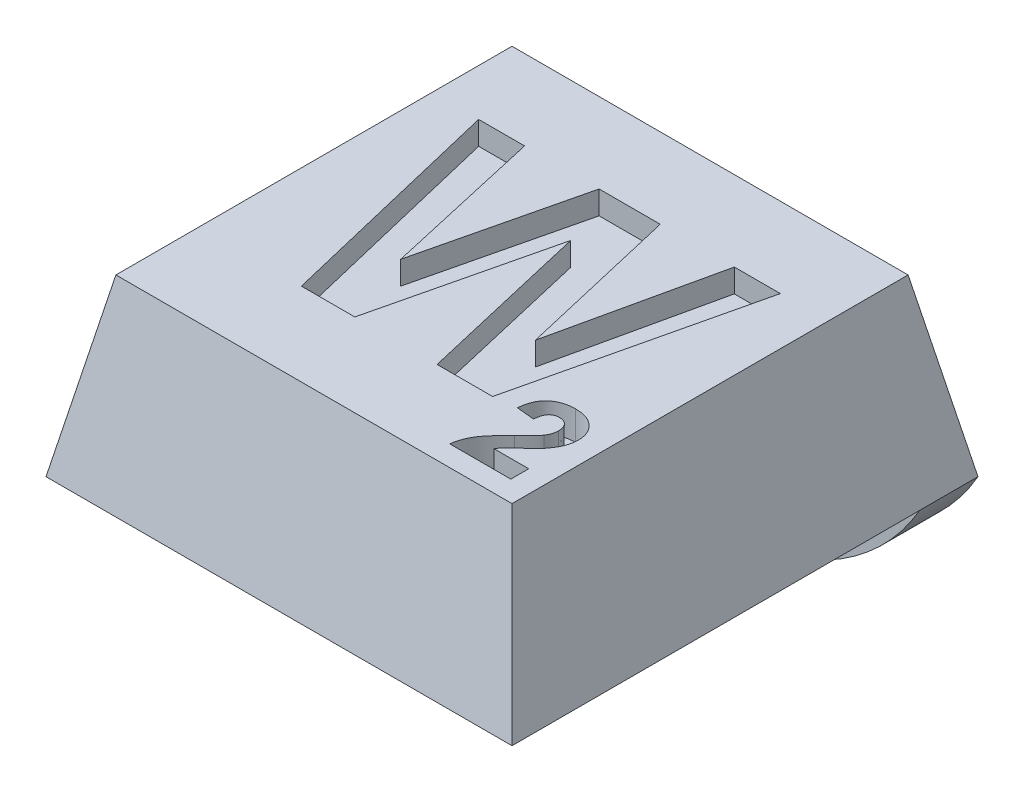
from build123d import *

# Parameters (mm, degrees)
SKETCH1_W               = 8
SKETCH1_H               = 8
BOSS_EXTRUDE1_DEPTH     = 3
CUT_EXTRUDE1_DEPTH      = 12.704699911
CUT_EXTRUDE1_DEPTH_BACK = 12.704699911
CUT_EXTRUDE2_DEPTH      = 11
SKETCH4_R               = 1.75
CUT_EXTRUDE3_DEPTH      = 0.4
SKETCH5_W               = 8
SKETCH5_H               = 1
BOSS_EXTRUDE2_DEPTH     = 2
FILLET1_R               = 4
CUT_EXTRUDE4_DEPTH      = 0.4
CUT_EXTRUDE5_DEPTH      = 0.5


with BuildPart() as part:
    # Sketch1 → Boss-Extrude1 (new body)
    with BuildSketch(Plane(origin=(0, 0, 0), x_dir=(1, 0, 0), z_dir=(0, 1, 0))):
        with Locations((4, 4)):
            Rectangle(SKETCH1_W, SKETCH1_H)
    extrude(amount=BOSS_EXTRUDE1_DEPTH)

    # Sketch2 → Cut-Extrude1 (cut, two sides: drawn at the far end of the back side and taken through both)
    with BuildSketch(Plane.XY.offset(-CUT_EXTRUDE1_DEPTH_BACK)):
        Polygon((0, 0), (0.6, 3), (0, 3), align=None)
        Polygon((8, 0), (7.4, 3), (8, 3), align=None)
    extrude(amount=CUT_EXTRUDE1_DEPTH + CUT_EXTRUDE1_DEPTH_BACK, mode=Mode.SUBTRACT)

    # Sketch3 → Cut-Extrude2 (cut)
    with BuildSketch(Plane(origin=(0, 0, 0), x_dir=(0, 0, -1), z_dir=(1, 0, 0))):
        Polygon((0, 0), (0.6, 3), (0, 3), align=None)
        Polygon((8, 3), (7.4, 3), (8, 0), align=None)
    extrude(amount=CUT_EXTRUDE2_DEPTH, mode=Mode.SUBTRACT)

    # Sketch4 → Cut-Extrude3 (cut)
    with BuildSketch(Plane.XZ):
        with Locations(Location((4, -3.75, 0), (0, 0, 270))):
            Circle(SKETCH4_R)
    extrude(amount=-CUT_EXTRUDE3_DEPTH, mode=Mode.SUBTRACT)

    # Sketch5 → Boss-Extrude2 (add)
    with BuildSketch(Plane.XZ):
        with Locations((4, -7.5)):
            Rectangle(SKETCH5_W, SKETCH5_H)
    extrude(amount=BOSS_EXTRUDE2_DEPTH)

    # Fillet1
    # the kernel refuses this fillet: 4 mm, written as the material it takes off along each edge
    with BuildSketch(Plane(origin=(8, -2, -16.660254038), x_dir=(0, 1, 0), z_dir=(0, 0, 1)), Plane(origin=(0, -2, 1.660254038), x_dir=(0, 1, 0), z_dir=(0, 0, -1))) as fillet1_piece_1:
        with BuildLine():
            CenterArc((4, 3.464101615), FILLET1_R, 180, 60)
            Line((0, 3.464101615), (-0.08, 3.464101615))
            Line((-0.08, 3.464101615), (-0.08, 0))
            Line((-0.08, 0), (0, -0.08))
            ThreePointArc((0, -0.08), (1, -0.08), (1.96, -0.069282032))
            Line((1.96, -0.069282032), (2, 0))
        make_face()
    extrude(amount=18.320508076, mode=Mode.SUBTRACT)

    # Sketch6 → Cut-Extrude4 (cut)
    with BuildSketch(Plane(origin=(0, 3, 0), x_dir=(1, 0, 0), z_dir=(0, 1, 0))):
        Polygon((2.358967796, 2.025988971), (1.401435745, 6.025988971), (2.189897284, 6.025988971), (2.811692155, 3.278392817), (3.469544719, 6.025988971), (4.519224207, 6.025988971), (5.170666514, 3.231918458), (5.790858822, 6.025988971), (6.580922925, 6.025988971), (5.641019078, 2.025988971), (4.688294719, 2.025988971), (3.991179335, 5.016373586), (3.275634463, 2.025988971), align=None)
    extrude(amount=-CUT_EXTRUDE4_DEPTH, mode=Mode.SUBTRACT)

    # Sketch7 → Cut-Extrude5 (cut)
    with BuildSketch(Plane(origin=(0, 3, 0), x_dir=(1, 0, 0), z_dir=(0, 1, 0))):
        with BuildLine():
            Line((7.025079926, 1.261869909), (7.025079926, 0.954177602))
            Line((7.025079926, 0.954177602), (5.978926079, 0.954177602))
            add(Edge.make_bspline(
                [(5.978926079, 0.954177602), (5.982468114, 0.980474374), (5.989550197, 1.033053173), (6.011445466, 1.109857564), (6.040668149, 1.184805528), (6.072383822, 1.245794978), (6.103928572, 1.294889387), (6.132549124, 1.335117725), (6.166692393, 1.37791895), (6.205862922, 1.423638586), (6.249844239, 1.472419552), (6.298964472, 1.524080492), (6.353457933, 1.578374089), (6.391795053, 1.615242112), (6.411618387, 1.634305807)],
                knots=[0, 0, 0, 0, 1.156289446, 2.311930546, 3.473459201, 4.661751613, 5.303057008, 6.018253237, 6.81459331, 7.690699809, 8.644447906, 9.679642995, 10.800191253, 12, 12, 12, 12], degree=3))
            add(Edge.make_bspline(
                [(6.411618387, 1.634305807), (6.427437635, 1.649575712), (6.457552822, 1.678645113), (6.500436909, 1.720271317), (6.538136439, 1.758537631), (6.571439659, 1.79245241), (6.599577217, 1.822879209), (6.622919237, 1.849340182), (6.641761343, 1.871943086), (6.651966244, 1.886282382), (6.656490182, 1.89263914)],
                knots=[0, 0, 0, 0, 1.480720495, 2.818855715, 4.024636094, 5.098235712, 6.019786162, 6.815086302, 7.474715479, 8, 8, 8, 8], degree=3))
            add(Edge.make_bspline(
                [(6.656490182, 1.89263914), (6.665754103, 1.908027503), (6.683623134, 1.937709873), (6.703218009, 1.984385935), (6.714979583, 2.031052356), (6.71659359, 2.062234592), (6.717387618, 2.077575038)],
                knots=[0, 0, 0, 0, 1.0911822, 2.104764037, 3.067617678, 4, 4, 4, 4], degree=3))
            add(Edge.make_bspline(
                [(6.717387618, 2.077575038), (6.716811351, 2.093538834), (6.7157211, 2.123741092), (6.706579153, 2.166362064), (6.690367393, 2.203000826), (6.668046783, 2.233769843), (6.639822327, 2.257877251), (6.606827118, 2.275690284), (6.568578157, 2.285538571), (6.541694532, 2.286833928), (6.527644028, 2.287510935)],
                knots=[0, 0, 0, 0, 1.193122327, 2.257294386, 3.237245624, 4.168877528, 5.075331632, 5.990371598, 6.949684428, 8, 8, 8, 8], degree=3))
            add(Edge.make_bspline(
                [(6.527644028, 2.287510935), (6.513688449, 2.286878661), (6.486729282, 2.285657243), (6.448414457, 2.274987105), (6.414896057, 2.256515974), (6.391009062, 2.235466338), (6.374872264, 2.214997095), (6.363877213, 2.197159499), (6.354400337, 2.17689052), (6.346003035, 2.154418352), (6.339370115, 2.129485554), (6.334028373, 2.102282013), (6.329723702, 2.072661336), (6.328354741, 2.052055079), (6.327644028, 2.041357089)],
                knots=[0, 0, 0, 0, 1.402788338, 2.709884207, 3.961032948, 5.225417836, 5.883680772, 6.578928686, 7.329201998, 8.132101139, 8.990263233, 9.922304639, 10.921339128, 12, 12, 12, 12], degree=3))
            Line((6.327644028, 2.041357089), (6.01995172, 2.071485294))
            add(Edge.make_bspline(
                [(6.01995172, 2.071485294), (6.022425519, 2.092258403), (6.027221819, 2.132534142), (6.039191066, 2.190383991), (6.054349674, 2.243753088), (6.073420305, 2.292542389), (6.095614746, 2.337062147), (6.122065099, 2.376644317), (6.15184716, 2.411727355), (6.184986668, 2.44229259), (6.221272944, 2.468437258), (6.259348879, 2.491775386), (6.299958585, 2.510920071), (6.342654946, 2.526698167), (6.387418668, 2.539307895), (6.434456788, 2.547645276), (6.483479006, 2.553509822), (6.516941776, 2.553951654), (6.534054285, 2.554177602)],
                knots=[0, 0, 0, 0, 1.270971563, 2.464210789, 3.586263665, 4.638946707, 5.643716971, 6.603612468, 7.52484387, 8.434700188, 9.336036235, 10.239171475, 11.145359471, 12.059630629, 13.003312604, 13.96741569, 14.960557767, 16, 16, 16, 16], degree=3))
            add(Edge.make_bspline(
                [(6.534054285, 2.554177602), (6.552657792, 2.553820052), (6.58889046, 2.553123679), (6.641783721, 2.547373025), (6.69147314, 2.537345926), (6.738393137, 2.524063615), (6.782061867, 2.506330758), (6.82284322, 2.484892472), (6.860095371, 2.458935129), (6.894373612, 2.429874295), (6.925015616, 2.397916799), (6.95185524, 2.363828728), (6.974341388, 2.327633829), (6.993210719, 2.289773279), (7.007221071, 2.249637846), (7.017429622, 2.207782494), (7.024198302, 2.164011958), (7.024782801, 2.134117674), (7.025079926, 2.118921192)],
                knots=[0, 0, 0, 0, 1.210756838, 2.35810096, 3.457354827, 4.507168606, 5.527358126, 6.519769748, 7.499700793, 8.476517721, 9.440526811, 10.376769937, 11.295256217, 12.209626307, 13.124630862, 14.055668209, 15.011616881, 16, 16, 16, 16], degree=3))
            add(Edge.make_bspline(
                [(7.025079926, 2.118921192), (7.024688468, 2.101480457), (7.023911876, 2.066880717), (7.016476584, 2.015731964), (7.005116907, 1.965762694), (6.988328197, 1.916850789), (6.967047205, 1.867822963), (6.939615495, 1.818569171), (6.907765206, 1.767604004), (6.882827684, 1.7346528), (6.86995172, 1.71763914)],
                knots=[0, 0, 0, 0, 0.953409949, 1.89141903, 2.821310783, 3.752688675, 4.715703262, 5.740811754, 6.833515735, 8, 8, 8, 8], degree=3))
            add(Edge.make_bspline(
                [(6.86995172, 1.71763914), (6.865085171, 1.711509707), (6.854662151, 1.698381883), (6.836929855, 1.678252394), (6.816379649, 1.656264646), (6.793301796, 1.632007081), (6.766933989, 1.606338723), (6.738224942, 1.578186143), (6.705911376, 1.548989439), (6.672442351, 1.518020294), (6.638827847, 1.487878461), (6.607931272, 1.459250402), (6.579866901, 1.433920718), (6.555941744, 1.410491095), (6.534748531, 1.390560588), (6.517051134, 1.373107183), (6.502518393, 1.358553413), (6.482493212, 1.335867777), (6.457013442, 1.305185447), (6.439087381, 1.275867612), (6.430528644, 1.261869909)],
                knots=[0, 0, 0, 0, 0.665555651, 1.425465941, 2.280616993, 3.225313414, 4.272635571, 5.410053715, 6.644756443, 7.976022804, 9.288331007, 10.484517221, 11.558462543, 12.503158964, 13.33222979, 14.032602617, 14.617328242, 15.080653724, 16.606167857, 18, 18, 18, 18], degree=3))
            Line((6.430528644, 1.261869909), (7.025079926, 1.261869909))
        make_face()
    extrude(amount=-CUT_EXTRUDE5_DEPTH, mode=Mode.SUBTRACT)


solid = part.part
